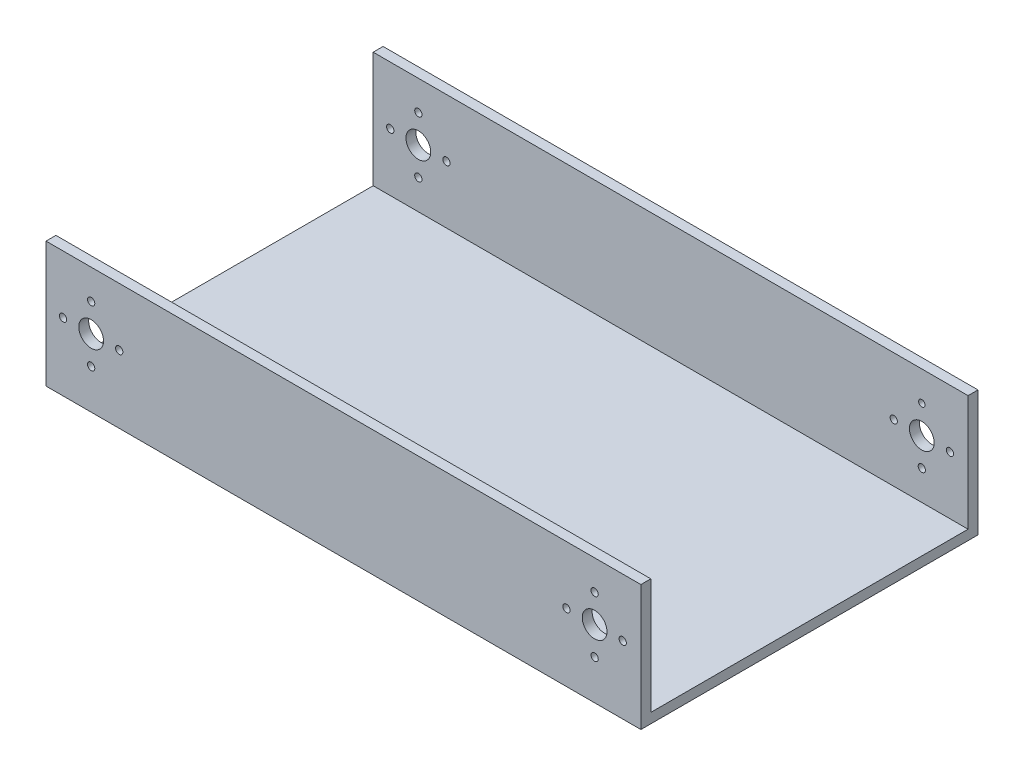
from build123d import *

# Parameters (mm, degrees)
SKETCH_1_W          = 180
SKETCH_1_H          = 35
EXTRUDE_1_DEPTH     = 3
SKETCH_2_R          = 3.75
CUT_EXTRUDE_1_DEPTH = 3
SKETCH_3_R          = 1.1
CUT_EXTRUDE_2_DEPTH = 3
SKETCH_4_W          = 180
SKETCH_4_H          = 102
EXTRUDE_2_DEPTH     = 3
SKETCH_5_W          = 180
SKETCH_5_H          = 3
EXTRUDE_3_DEPTH     = 35
CUT_EXTRUDE_START   = -35
SKETCH_6_R          = 3.75
SKETCH_6_R_2        = 1.1
SKETCH_6_R_3        = 0.981653735
CUT_EXTRUDE_3_DEPTH = 35


with BuildPart() as part:
    # 스케치1 → 보스-돌출1 (new body)
    with BuildSketch(Plane.XY):
        Rectangle(SKETCH_1_W, SKETCH_1_H)
    extrude(amount=EXTRUDE_1_DEPTH)

    # 스케치2 → 컷-돌출1 (cut)
    with BuildSketch(Plane.XY.offset(3)):
        with Locations((-76.33997629, 0)):
            Circle(SKETCH_2_R)
        with Locations((76, 0)):
            Circle(SKETCH_2_R)
    extrude(amount=-CUT_EXTRUDE_1_DEPTH, mode=Mode.SUBTRACT)

    # 스케치3 → 컷-돌출2 (cut)
    with BuildSketch(Plane.XY.offset(3)):
        with Locations((-76.33997629, 8.5)):
            Circle(SKETCH_3_R)
        with Locations((-76.33997629, -8.5)):
            Circle(SKETCH_3_R)
        with Locations((-84.83997629, 0)):
            Circle(SKETCH_3_R)
        with Locations((-67.83997629, 0)):
            Circle(SKETCH_3_R)
        with Locations((76, 8.5)):
            Circle(SKETCH_3_R)
        with Locations((76, -8.5)):
            Circle(SKETCH_3_R)
        with Locations((67.5, 0)):
            Circle(SKETCH_3_R)
        with Locations((84.5, 0)):
            Circle(SKETCH_3_R)
    extrude(amount=-CUT_EXTRUDE_2_DEPTH, mode=Mode.SUBTRACT)

    # 스케치4 → 보스-돌출2 (add)
    with BuildSketch(Plane.XZ.offset(17.5)):
        with Locations((0, -48)):
            Rectangle(SKETCH_4_W, SKETCH_4_H)
    extrude(amount=EXTRUDE_2_DEPTH)

    # 스케치5 → 보스-돌출3 (add)
    with BuildSketch(Plane(origin=(0, -17.5, 0), x_dir=(1, 0, 0), z_dir=(0, 1, 0))):
        with Locations((0, 97.5)):
            Rectangle(SKETCH_5_W, SKETCH_5_H)
    extrude(amount=EXTRUDE_3_DEPTH)

    # 스케치6 → 컷-돌출3 (cut)
    with BuildSketch(Plane(origin=(0, 0, -99), x_dir=(-1, 0, 0), z_dir=(0, 0, -1)).offset(CUT_EXTRUDE_START)):
        with Locations((-76, 0)):
            Circle(SKETCH_6_R)
        with Locations((76.33997629, 0)):
            Circle(SKETCH_6_R)
        with Locations((-76, -8.5)):
            Circle(SKETCH_6_R_2)
        with Locations((-67.5, 0)):
            Circle(SKETCH_6_R_2)
        with Locations((-76, 8.5)):
            Circle(SKETCH_6_R_3)
        with Locations((-84.5, 0)):
            Circle(SKETCH_6_R_2)
        with Locations((84.83997629, 0)):
            Circle(SKETCH_6_R_2)
        with Locations((76.33997629, 8.5)):
            Circle(SKETCH_6_R_2)
        with Locations((67.83997629, 0)):
            Circle(SKETCH_6_R_2)
        with Locations((76.33997629, -8.5)):
            Circle(SKETCH_6_R_2)
    extrude(amount=CUT_EXTRUDE_3_DEPTH, mode=Mode.SUBTRACT)


solid = part.part
